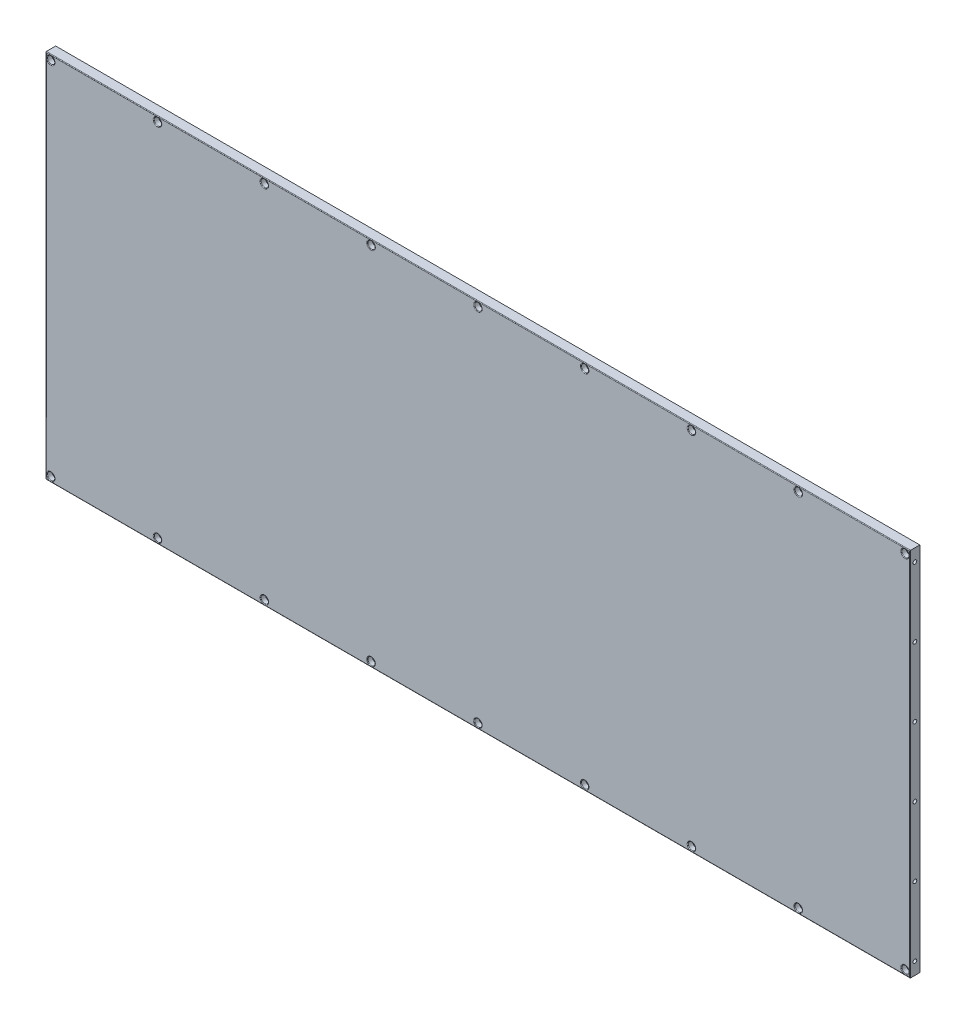
from build123d import *

# Parameters (mm, degrees)
SKETCH1_W               = 700
SKETCH1_H               = 300
BOSS_EXTRUDE1_DEPTH     = 8
SKETCH4_R               = 3
CUT_EXTRUDE2_DEPTH      = 4
LPATTERN1_COUNT         = 9
LPATTERN1_PITCH         = 86.5
LPATTERN1_COUNT_DIR2    = 2
LPATTERN1_PITCH_DIR2    = 292
SKETCH7_R               = 1.5
CUT_EXTRUDE7_DEPTH      = 20
FILLET1_R               = 0.5
LPATTERN2_COUNT         = 6
LPATTERN2_PITCH         = 56
MIRROR1_COPY_1_SKETCH_R = 1.5
MIRROR1_COPY_1_DEPTH    = 20
MIRROR1_COPY_2_SKETCH_R = 1.5
MIRROR1_COPY_2_DEPTH    = 20
MIRROR1_COPY_3_SKETCH_R = 1.5
MIRROR1_COPY_3_DEPTH    = 20
MIRROR1_COPY_4_SKETCH_R = 1.5
MIRROR1_COPY_4_DEPTH    = 20
MIRROR1_COPY_5_SKETCH_R = 1.5
MIRROR1_COPY_5_DEPTH    = 20


with BuildPart() as part:
    # Sketch1 → Boss-Extrude1 (new body)
    with BuildSketch(Plane.XY):
        with Locations((350, 150)):
            Rectangle(SKETCH1_W, SKETCH1_H)
    extrude(amount=BOSS_EXTRUDE1_DEPTH)

    # Sketch4 → Cut-Extrude2 (cut)
    with BuildSketch(Plane.XY.offset(8)):
        with Locations((4, 296)):
            Circle(SKETCH4_R)
    cut_extrude2 = extrude(amount=-CUT_EXTRUDE2_DEPTH, mode=Mode.SUBTRACT)

    # LPattern1: Cut-Extrude2 9 × 2
    with Locations(*[(i * LPATTERN1_PITCH, -j * LPATTERN1_PITCH_DIR2, 0) for i in range(LPATTERN1_COUNT) for j in range(LPATTERN1_COUNT_DIR2) if (i, j) != (0, 0)]):
        add(cut_extrude2, mode=Mode.SUBTRACT)

    # Sketch7 → Cut-Extrude7 (cut)
    with BuildSketch(Plane(origin=(0, 0, 4), x_dir=(0, 0, -1), z_dir=(1, 0, 0))):
        with Locations((0, 290)):
            Circle(SKETCH7_R)
    cut_extrude7 = extrude(amount=CUT_EXTRUDE7_DEPTH, mode=Mode.SUBTRACT)

    # Fillet1
    fillet1_edges = [part.edges().sort_by_distance(p)[0] for p in [
        (700, 150, 8),
        (350, 300, 8),
        (1, 296, 8),
        (87.5, 296, 8),
        (174, 296, 8),
        (260.5, 296, 8),
        (347, 296, 8),
        (433.5, 296, 8),
        (520, 296, 8),
        (606.5, 296, 8),
        (693, 296, 8),
        (1, 4, 8),
        (87.5, 4, 8),
        (174, 4, 8),
        (0, 150, 8),
        (260.5, 4, 8),
        (347, 4, 8),
        (433.5, 4, 8),
        (520, 4, 8),
        (606.5, 4, 8),
        (693, 4, 8),
        (350, 0, 8),
    ]]
    fillet(fillet1_edges, radius=FILLET1_R - 0.0001)  # a hair under: the kernel refuses the full size

    # LPattern2: Cut-Extrude7 ×6
    with Locations(*[(0, -i * LPATTERN2_PITCH, 0) for i in range(1, LPATTERN2_COUNT)]):
        add(cut_extrude7, mode=Mode.SUBTRACT)

    # Mirror1: Cut-Extrude7 across plane
    add(cut_extrude7.mirror(Plane(origin=(350, 0, 0), x_dir=(0, 0, 1), z_dir=(1, 0, 0))), mode=Mode.SUBTRACT)

    # Mirror1 copy 1 sketch → Mirror1 copy 1 (cut)
    with BuildSketch(Plane(origin=(700, -56, 4), x_dir=(0, 0, -1), z_dir=(-1, 0, 0))):
        with Locations((0, -290)):
            Circle(MIRROR1_COPY_1_SKETCH_R)
    extrude(amount=MIRROR1_COPY_1_DEPTH, mode=Mode.SUBTRACT)

    # Mirror1 copy 2 sketch → Mirror1 copy 2 (cut)
    with BuildSketch(Plane(origin=(700, -112, 4), x_dir=(0, 0, -1), z_dir=(-1, 0, 0))):
        with Locations((0, -290)):
            Circle(MIRROR1_COPY_2_SKETCH_R)
    extrude(amount=MIRROR1_COPY_2_DEPTH, mode=Mode.SUBTRACT)

    # Mirror1 copy 3 sketch → Mirror1 copy 3 (cut)
    with BuildSketch(Plane(origin=(700, -168, 4), x_dir=(0, 0, -1), z_dir=(-1, 0, 0))):
        with Locations((0, -290)):
            Circle(MIRROR1_COPY_3_SKETCH_R)
    extrude(amount=MIRROR1_COPY_3_DEPTH, mode=Mode.SUBTRACT)

    # Mirror1 copy 4 sketch → Mirror1 copy 4 (cut)
    with BuildSketch(Plane(origin=(700, -224, 4), x_dir=(0, 0, -1), z_dir=(-1, 0, 0))):
        with Locations((0, -290)):
            Circle(MIRROR1_COPY_4_SKETCH_R)
    extrude(amount=MIRROR1_COPY_4_DEPTH, mode=Mode.SUBTRACT)

    # Mirror1 copy 5 sketch → Mirror1 copy 5 (cut)
    with BuildSketch(Plane(origin=(700, -280, 4), x_dir=(0, 0, -1), z_dir=(-1, 0, 0))):
        with Locations((0, -290)):
            Circle(MIRROR1_COPY_5_SKETCH_R)
    extrude(amount=MIRROR1_COPY_5_DEPTH, mode=Mode.SUBTRACT)


solid = part.part
